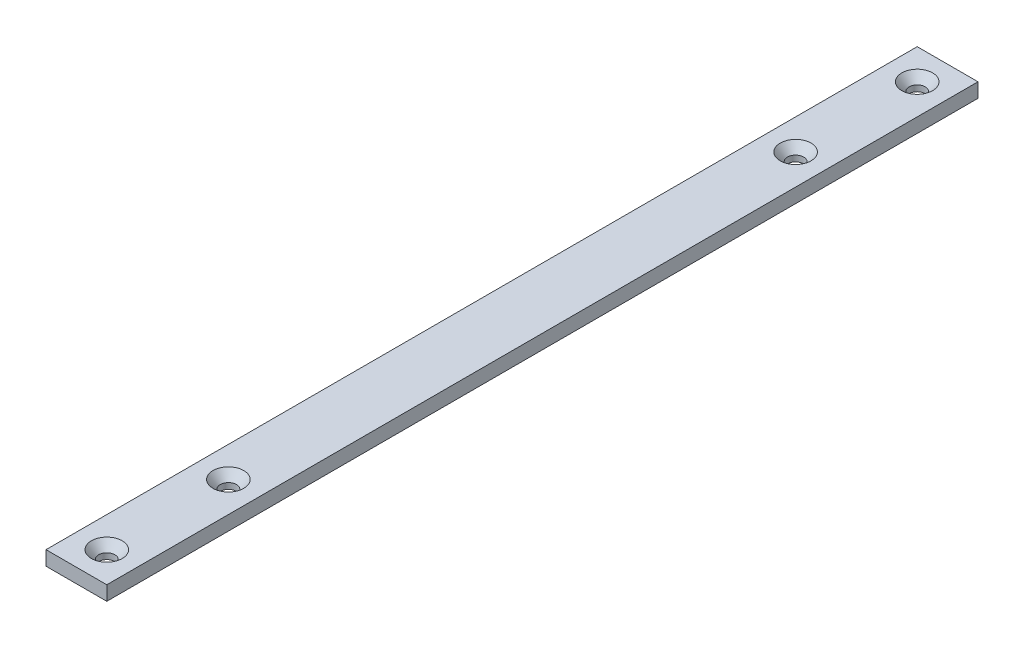
from build123d import *

# Parameters (mm, degrees)
SKETCH3_W                                     = 25.4
SKETCH3_H                                     = 6
BOSS_EXTRUDE1_DEPTH                           = 182
CSK_FOR_1_4_FLAT_HEAD_MACHINE_SCREW1_AT_COUNT = 2
CSK_FOR_1_4_FLAT_HEAD_MACHINE_SCREW1_AT_PITCH = 338.6
CSK_FOR_1_4_FLAT_HEAD_MACHINE_SCREW1_2_COUNT  = 2
CSK_FOR_1_4_FLAT_HEAD_MACHINE_SCREW1_2_PITCH  = 50.8
CSK_FOR_1_4_FLAT_HEAD_MACHINE_SCREW1_3_COUNT  = 2
CSK_FOR_1_4_FLAT_HEAD_MACHINE_SCREW1_3_PITCH  = 287.8


with BuildPart() as part:
    # Sketch3 → Boss-Extrude1 (new, symmetric)
    with BuildSketch(Plane.XY):
        Rectangle(SKETCH3_W, SKETCH3_H)
    extrude(amount=BOSS_EXTRUDE1_DEPTH, both=True)

    # Sketch8 → CSK for 1/4 Flat Head Machine Screw1 (revolve, cut)
    with BuildSketch(Plane(origin=(0, 3, -169.3), x_dir=(0, 0, 1), z_dir=(1, 0, 0))):
        Polygon((0, 0), (0, 6), (3.3782, 6), (3.3782, 3.520932584), (6.4389, 0), align=None)
    csk_for_1_4_flat_head_machine_screw1 = revolve(axis=Axis((0, 9.35, -169.3), (0, -1, 0)), mode=Mode.SUBTRACT)

    # CSK for 1/4 Flat Head Machine Screw1 at: CSK for 1/4 Flat Head Machine Screw1 ×2
    with Locations(*[(0, 0, i * CSK_FOR_1_4_FLAT_HEAD_MACHINE_SCREW1_AT_PITCH) for i in range(1, CSK_FOR_1_4_FLAT_HEAD_MACHINE_SCREW1_AT_COUNT)]):
        add(csk_for_1_4_flat_head_machine_screw1, mode=Mode.SUBTRACT)

    # CSK for 1_4 Flat Head Machine Screw1 2: CSK for 1/4 Flat Head Machine Screw1 ×2
    with Locations(*[(0, 0, i * CSK_FOR_1_4_FLAT_HEAD_MACHINE_SCREW1_2_PITCH) for i in range(1, CSK_FOR_1_4_FLAT_HEAD_MACHINE_SCREW1_2_COUNT)]):
        add(csk_for_1_4_flat_head_machine_screw1, mode=Mode.SUBTRACT)

    # CSK for 1_4 Flat Head Machine Screw1 3: CSK for 1/4 Flat Head Machine Screw1 ×2
    with Locations(*[(0, 0, i * CSK_FOR_1_4_FLAT_HEAD_MACHINE_SCREW1_3_PITCH) for i in range(1, CSK_FOR_1_4_FLAT_HEAD_MACHINE_SCREW1_3_COUNT)]):
        add(csk_for_1_4_flat_head_machine_screw1, mode=Mode.SUBTRACT)


solid = part.part
